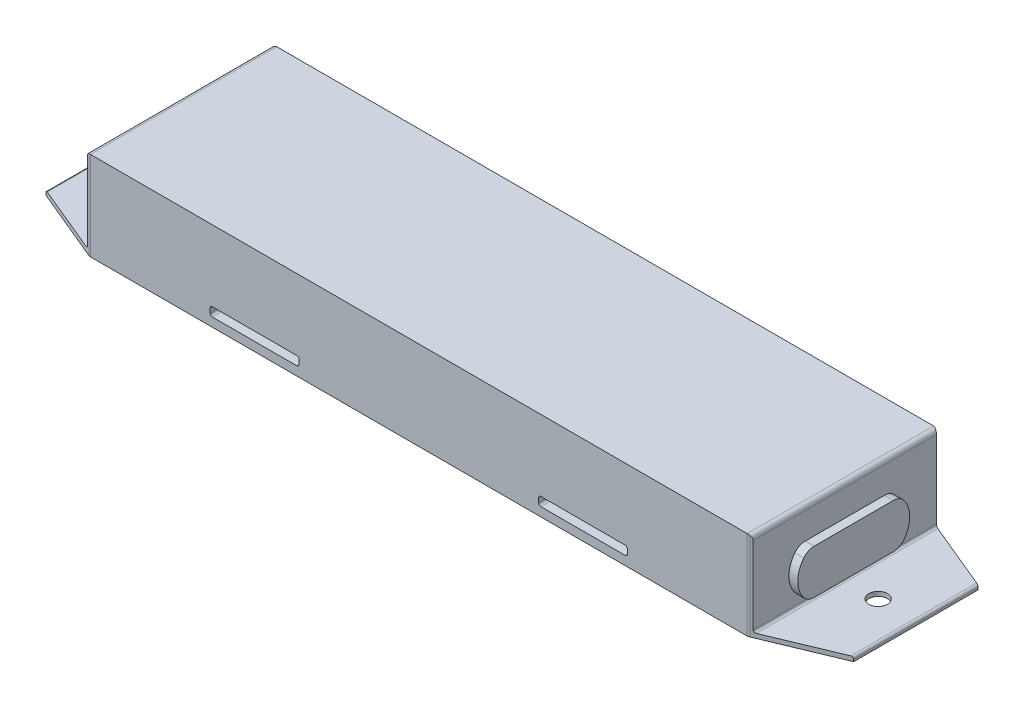
from build123d import *

# Parameters (mm, degrees)
EXTRUDE_START           = 21
EXTRUDE_1_DEPTH         = 42
CUT_EXTRUDE_4_OUTLINE_R = 2.1
CUT_EXTRUDE_4_DEPTH     = 20
EXTRUDE_2_DEPTH         = 2


# Read off the part's stored shape, not the designer's step: ｶｯﾄ - 押し出し4
with BuildPart() as part:
    # ｽｹｯﾁ2 → ﾎﾞｽ - 押し出し1 (new body)
    with BuildSketch(Plane.XY.offset(EXTRUDE_START)):
        with BuildLine():
            ThreePointArc((-75.5, 1), (-75.146446609, 1.146446609), (-75, 1.5))
            Line((-75, 1.5), (-75, 19))
            ThreePointArc((-75, 19), (-74.707106781, 19.707106781), (-74, 20))
            Line((-74, 20), (74, 20))
            ThreePointArc((74, 20), (74.707106781, 19.707106781), (75, 19))
            Line((75, 19), (75, 1.5))
            ThreePointArc((75, 1.5), (75.146446609, 1.146446609), (75.5, 1))
            Line((75.5, 1), (90.5, 1))
            ThreePointArc((90.5, 1), (90.853553391, 0.853553391), (91, 0.5))
            Line((91, 0.5), (91, 0))
            Line((91, 0), (-91, 0))
            Line((-91, 0), (-91, 0.5))
            ThreePointArc((-91, 0.5), (-90.853553391, 0.853553391), (-90.5, 1))
            Line((-90.5, 1), (-75.5, 1))
        make_face()
        with BuildLine():
            ThreePointArc((-27.5, 2), (-27.146446609, 2.146446609), (-27, 2.5))
            Line((-27, 2.5), (-27, 3.5))
            ThreePointArc((-27, 3.5), (-27.146446609, 3.853553391), (-27.5, 4))
            Line((-27.5, 4), (-46.5, 4))
            ThreePointArc((-46.5, 4), (-46.853553391, 3.853553391), (-47, 3.5))
            Line((-47, 3.5), (-47, 2.5))
            ThreePointArc((-47, 2.5), (-46.853553391, 2.146446609), (-46.5, 2))
            Line((-46.5, 2), (-27.5, 2))
        make_face(mode=Mode.SUBTRACT)
        with BuildLine():
            ThreePointArc((27, 2.5), (27.146446609, 2.146446609), (27.5, 2))
            Line((27.5, 2), (46.5, 2))
            ThreePointArc((46.5, 2), (46.853553391, 2.146446609), (47, 2.5))
            Line((47, 2.5), (47, 3.5))
            ThreePointArc((47, 3.5), (46.853553391, 3.853553391), (46.5, 4))
            Line((46.5, 4), (27.5, 4))
            ThreePointArc((27.5, 4), (27.146446609, 3.853553391), (27, 3.5))
            Line((27, 3.5), (27, 2.5))
        make_face(mode=Mode.SUBTRACT)
    extrude(amount=-EXTRUDE_1_DEPTH)

    # ｶｯﾄ - 押し出し4 outline → ｶｯﾄ - 押し出し4 (cut)
    with BuildSketch(Plane(origin=(0, 0, 0), x_dir=(1, 0, 0), z_dir=(0, 1, 0))):
        with BuildLine():
            ThreePointArc((-74, -21), (-74.214440627, -20.976737026), (-74.418904201, -20.908030435))
            Line((-74.418904201, -20.908030435), (-91, -14))
            Line((-91, -14), (-91, -21))
            Line((-91, -21), (-74, -21))
        make_face()
        with BuildLine():
            ThreePointArc((74.488899944, -20.872339868), (74.252646128, -20.96755875), (74, -21))
            Line((74, -21), (91, -21))
            Line((91, -21), (91, -14))
            Line((91, -14), (74.488899944, -20.872339868))
        make_face()
        Polygon((-74.21393, 21), (-91, 21), (-91, 14), align=None)
        with BuildLine():
            Line((-91, 2.1), (-91, -2.1))
            Line((-91, -2.1), (-82.5, -2.1))
            ThreePointArc((-82.5, -2.1), (-80.4, 0), (-82.5, 2.1))
            Line((-82.5, 2.1), (-91, 2.1))
        make_face()
        with BuildLine():
            Line((91, 21), (74, 21))
            ThreePointArc((74, 21), (74.260916595, 20.965361347), (74.503757591, 20.863845061))
            Line((74.503757591, 20.863845061), (91, 14))
            Line((91, 14), (91, 21))
        make_face()
        with Locations((82.5, 0)):
            Circle(CUT_EXTRUDE_4_OUTLINE_R)
    extrude(amount=CUT_EXTRUDE_4_DEPTH, mode=Mode.SUBTRACT)

    # ｽｹｯﾁ5 → ﾎﾞｽ - 押し出し2 (add)
    with BuildSketch(Plane(origin=(75, 0, 0), x_dir=(0, 0, -1), z_dir=(1, 0, 0))):
        with BuildLine():
            Line((-8.925734, 3), (8.925734, 3))
            ThreePointArc((8.925734, 3), (10.240738094, 3.303564532), (11.289616453, 4.152823844))
            ThreePointArc((11.289616453, 4.152823844), (12.612818852, 8.006934379), (11.275142981, 11.856045429))
            ThreePointArc((11.275142981, 11.856045429), (10.228153822, 12.698901284), (8.918218, 13))
            Line((8.918218, 13), (-8.918218, 13))
            ThreePointArc((-8.918218, 13), (-10.228153822, 12.698901284), (-11.275142981, 11.856045429))
            ThreePointArc((-11.275142981, 11.856045429), (-12.612818852, 8.006934379), (-11.289616453, 4.152823844))
            ThreePointArc((-11.289616453, 4.152823844), (-10.240738094, 3.303564532), (-8.925734, 3))
        make_face()
    extrude(amount=EXTRUDE_2_DEPTH)


solid = part.part
